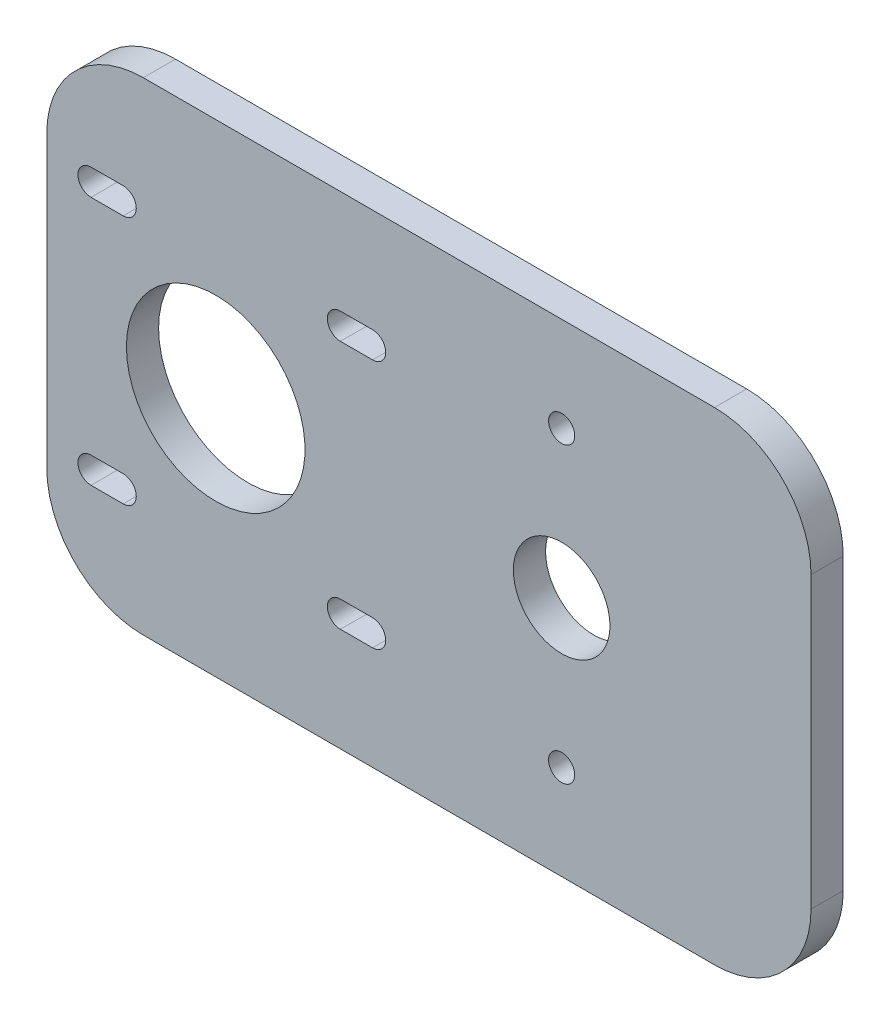
from build123d import *

# Parameters (mm, degrees)
CROQUIS1_W              = 95
CROQUIS1_H              = 60
SALIENTE_EXTRUIR1_DEPTH = 4
CROQUIS2_R              = 11.1
CROQUIS2_R_2            = 6
CROQUIS2_R_3            = 1.625
CORTAR_EXTRUIR1_DEPTH   = 113.432201793
REDONDEO1_R             = 12


with BuildPart() as part:
    # Croquis1 → Saliente-Extruir1 (new body)
    with BuildSketch(Plane.XY):
        with Locations((47.5, 30)):
            Rectangle(CROQUIS1_W, CROQUIS1_H)
    extrude(amount=SALIENTE_EXTRUIR1_DEPTH)

    # Croquis2 → Cortar-Extruir1 (cut, through all)
    with BuildSketch(Plane(origin=(0, 0, 0), x_dir=(-1, 0, 0), z_dir=(0, 0, -1))):
        with Locations((-21, 30)):
            Circle(CROQUIS2_R)
        with Locations((-64, 30)):
            Circle(CROQUIS2_R_2)
        with Locations((-64, 11.75)):
            Circle(CROQUIS2_R_3)
        with Locations((-64, 48.25)):
            Circle(CROQUIS2_R_3)
        with BuildLine():
            Line((-36.5, 43.875), (-40.5, 43.875))
            ThreePointArc((-40.5, 43.875), (-42.125, 45.5), (-40.5, 47.125))
            Line((-40.5, 47.125), (-36.5, 47.125))
            ThreePointArc((-36.5, 47.125), (-34.875, 45.5), (-36.5, 43.875))
        make_face()
        with BuildLine():
            Line((-36.5, 12.875), (-40.5, 12.875))
            ThreePointArc((-40.5, 12.875), (-42.125, 14.5), (-40.5, 16.125))
            Line((-40.5, 16.125), (-36.5, 16.125))
            ThreePointArc((-36.5, 16.125), (-34.875, 14.5), (-36.5, 12.875))
        make_face()
        with BuildLine():
            Line((-5.5, 12.875), (-9.5, 12.875))
            ThreePointArc((-9.5, 12.875), (-11.125, 14.5), (-9.5, 16.125))
            Line((-9.5, 16.125), (-5.5, 16.125))
            ThreePointArc((-5.5, 16.125), (-3.875, 14.5), (-5.5, 12.875))
        make_face()
        with BuildLine():
            Line((-5.5, 43.875), (-9.5, 43.875))
            ThreePointArc((-9.5, 43.875), (-11.125, 45.5), (-9.5, 47.125))
            Line((-9.5, 47.125), (-5.5, 47.125))
            ThreePointArc((-5.5, 47.125), (-3.875, 45.5), (-5.5, 43.875))
        make_face()
    extrude(amount=-CORTAR_EXTRUIR1_DEPTH, mode=Mode.SUBTRACT)

    # Redondeo1
    redondeo1_edges = [part.edges().sort_by_distance(p)[0] for p in [
        (95, 0, 2),
        (95, 60, 2),
        (0, 0, 2),
        (0, 60, 2),
    ]]
    fillet(redondeo1_edges, radius=REDONDEO1_R)


solid = part.part
